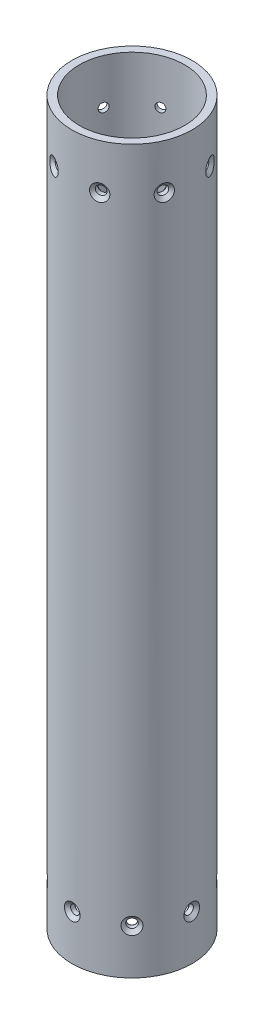
from build123d import *

# Parameters (mm, degrees)
SKETCH1_R                 = 25.4
SKETCH1_R_2               = 22.225
BODY_DEPTH                = 304.8
BOTTOM_BOLT_PATTERN_COUNT = 8
TOP_BOLT_PATTERN_COUNT    = 8


with BuildPart() as part:
    # Sketch1 → body (new body)
    with BuildSketch(Plane(origin=(0, 0, 0), x_dir=(1, 0, 0), z_dir=(0, 1, 0))):
        Circle(SKETCH1_R)
        Circle(SKETCH1_R_2, mode=Mode.SUBTRACT)
    extrude(amount=BODY_DEPTH)

    # Sketch2 → CSK for _6 Flat Head Machine Screw _100 (revolve, cut)
    with BuildSketch(Plane(origin=(25.4, 19.05, 0), x_dir=(0, 0, -1), z_dir=(0, 1, 0))):
        Polygon((0, 0), (0, 4.315824014), (1.89865, 3.175), (1.89865, 1.380025208), (3.5433, 0), align=None)
    csk_for_6_flat_head_machine_screw_100 = revolve(axis=Axis((31.75, 19.05, 0), (-1, 0, 0)), mode=Mode.SUBTRACT)

    # bottom-bolt-pattern: CSK for _6 Flat Head Machine Screw _100 ×8 about axis
    bottom_bolt_pattern_axis = Axis((0, 304.8, 0), (0, -1, 0))
    for i in range(1, BOTTOM_BOLT_PATTERN_COUNT):
        add(csk_for_6_flat_head_machine_screw_100.rotate(bottom_bolt_pattern_axis, i * 360 / BOTTOM_BOLT_PATTERN_COUNT), mode=Mode.SUBTRACT)

    # Sketch4 → CSK for _6 Flat Head Machine Screw _ 2 (revolve, cut)
    with BuildSketch(Plane(origin=(9.720159182, 285.75, -23.466540126), x_dir=(-0.9238795325112865, 0, -0.3826834323650905), z_dir=(0, 1, 0))):
        Polygon((0, 0), (0, 4.315824014), (1.89865, 3.175), (1.89865, 1.380025208), (3.5433, 0), align=None)
    csk_for_6_flat_head_machine_screw_2 = revolve(axis=Axis((12.150198978, 285.75, -29.333175157), (-0.38268343236509045, 0, 0.9238795325112865)), mode=Mode.SUBTRACT)

    # top-bolt-pattern: CSK for _6 Flat Head Machine Screw _ 2 ×8 about axis
    top_bolt_pattern_axis = Axis((0, 304.8, 0), (0, -1, 0))
    for i in range(1, TOP_BOLT_PATTERN_COUNT):
        add(csk_for_6_flat_head_machine_screw_2.rotate(top_bolt_pattern_axis, i * 360 / TOP_BOLT_PATTERN_COUNT), mode=Mode.SUBTRACT)


solid = part.part
